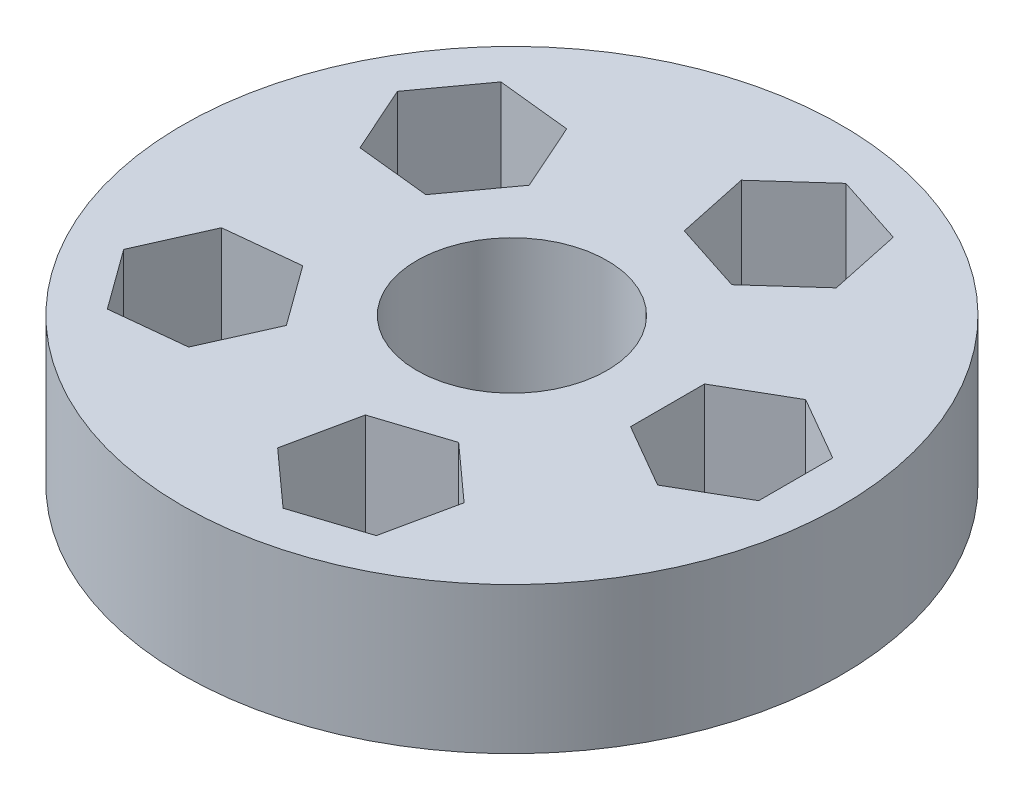
from build123d import *

# Parameters (mm, degrees)
SKETCH1_R           = 28.575
SKETCH1_R_2         = 8.255
SKETCH1_R_3         = 3.2004
BOSS_EXTRUDE1_DEPTH = 12.7
CUT_EXTRUDE1_DEPTH  = 9.525


with BuildPart() as part:
    # Sketch1 → Boss-Extrude1 (new body)
    with BuildSketch(Plane(origin=(0, 0, 0), x_dir=(1, 0, 0), z_dir=(0, 1, 0))):
        Circle(SKETCH1_R)
        Circle(SKETCH1_R_2, mode=Mode.SUBTRACT)
        with Locations((19.05, 0)):
            Circle(SKETCH1_R_3, mode=Mode.SUBTRACT)
        with Locations((5.886773743, -18.117626635)):
            Circle(SKETCH1_R_3, mode=Mode.SUBTRACT)
        with Locations((-15.411773743, -11.197309056)):
            Circle(SKETCH1_R_3, mode=Mode.SUBTRACT)
        with Locations((-15.411773743, 11.197309056)):
            Circle(SKETCH1_R_3, mode=Mode.SUBTRACT)
        with Locations((5.886773743, 18.117626635)):
            Circle(SKETCH1_R_3, mode=Mode.SUBTRACT)
    extrude(amount=BOSS_EXTRUDE1_DEPTH)

    # Sketch2 → Cut-Extrude1 (cut)
    with BuildSketch(Plane(origin=(0, 12.7, 0), x_dir=(1, 0, 0), z_dir=(0, 1, 0))):
        Polygon((1.118901555, 13.824615235), (7.220694581, 11.842022499), (11.988566768, 16.135033899), (10.654645931, 22.410638036), (4.552852905, 24.393230772), (-0.215019283, 20.100219372), align=None)
        Polygon((13.49375, 3.207902433), (13.49375, -3.207902433), (19.05, -6.415804866), (24.60625, -3.207902433), (24.60625, 3.207902433), (19.05, 6.415804866), align=None)
        Polygon((7.220694581, -11.842022499), (1.118901555, -13.824615235), (-0.215019283, -20.100219372), (4.552852905, -24.393230772), (10.654645931, -22.410638036), (11.988566768, -16.135033899), align=None)
        Polygon((-9.031115327, -10.526674833), (-12.802230809, -5.336179663), (-19.182889225, -6.006813887), (-21.792432159, -11.867943279), (-18.021316677, -17.058438449), (-11.640658261, -16.387804226), align=None)
        Polygon((-12.802230809, 5.336179663), (-9.031115327, 10.526674833), (-11.640658261, 16.387804226), (-18.021316677, 17.058438449), (-21.792432159, 11.867943279), (-19.182889225, 6.006813887), align=None)
    extrude(amount=-CUT_EXTRUDE1_DEPTH, mode=Mode.SUBTRACT)


solid = part.part
